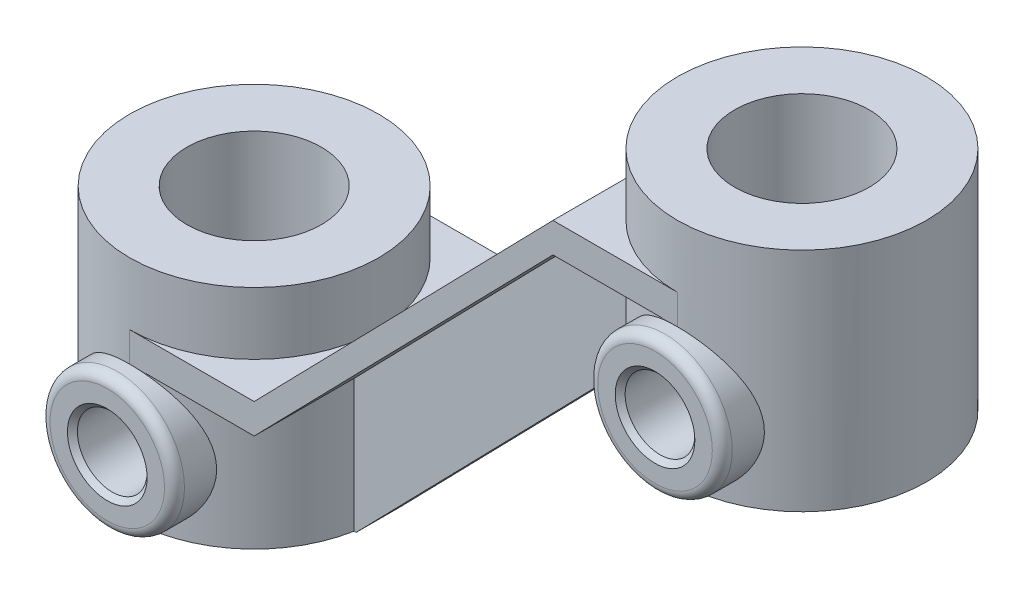
from build123d import *

# Parameters (mm, degrees)
BOSS_EXTRUDE1_START     = 61.5
SKETCH2_R               = 25
SKETCH2_R_2             = 13.5
BOSS_EXTRUDE1_DEPTH     = 45.5
SKETCH2_3_R             = 25
SKETCH2_3_R_2           = 13.5
BOSS_EXTRUDE2_DEPTH     = 45.5
BOSS_EXTRUDE3_DEPTH     = 25
BOSS_EXTRUDE5_REACH     = 205.566
BOSS_EXTRUDE5_START     = 29.5
SKETCH4_R               = 13.5
RIB1_START              = -4.5
RIB1_DEPTH              = 9
FILLET1_R               = 2
CUT_EXTRUDE3_DEPTH      = 175.769133569
CUT_EXTRUDE3_DEPTH_BACK = 52.5
SKETCH10_R              = 13.5


with BuildPart() as part:
    # Sketch2 → Boss-Extrude1 (new body)
    with BuildSketch(Plane(origin=(0, 0, 0), x_dir=(1, 0, 0), z_dir=(0, 1, 0)).offset(BOSS_EXTRUDE1_START)):
        with Locations(Location((110, 0, 0), (0, 0, 270))):
            Circle(SKETCH2_R)
        with Locations(Location((110, 0, 0), (0, 0, 270))):
            Circle(SKETCH2_R_2, mode=Mode.SUBTRACT)
    extrude(amount=BOSS_EXTRUDE1_DEPTH)



with BuildPart() as body_2:
    # Sketch2<3> → Boss-Extrude2 (new body)
    with BuildSketch(Plane(origin=(0, 0, 0), x_dir=(1, 0, 0), z_dir=(0, 1, 0))):
        with Locations(Location((0, 0, 0), (0, 0, 270))):
            Circle(SKETCH2_3_R)
        with Locations(Location((0, 0, 0), (0, 0, 270))):
            Circle(SKETCH2_3_R_2, mode=Mode.SUBTRACT)
    extrude(amount=BOSS_EXTRUDE2_DEPTH)


with BuildPart() as part_1:
    add(part.part)

    add(body_2.part)  # Boss-Extrude3 merges body 2
    # Sketch3 → Boss-Extrude3 (add, symmetric)
    with BuildSketch(Plane.XY):
        Polygon((0, 27), (25, 27), (85, 88.5), (110, 88.5), (110, 94.5), (85, 94.5), (25, 33), (0, 33), align=None)
    extrude(amount=BOSS_EXTRUDE3_DEPTH, both=True)

    # Sketch4 → Boss-Extrude5 (add, up to next)
    with BuildSketch(Plane.XY.offset(BOSS_EXTRUDE5_START), mode=Mode.PRIVATE) as boss_extrude5_sk1:
        with Locations((0, 13.5)):
            Circle(SKETCH4_R)
    boss_extrude5_tool1 = extrude(boss_extrude5_sk1.sketch, amount=-BOSS_EXTRUDE5_REACH, mode=Mode.PRIVATE) - part_1.part
    # Sketch4 → Boss-Extrude5 (add, up to next)
    with BuildSketch(Plane.XY.offset(BOSS_EXTRUDE5_START), mode=Mode.PRIVATE) as boss_extrude5_sk2:
        with Locations((110, 75)):
            Circle(SKETCH4_R)
    boss_extrude5_tool2 = extrude(boss_extrude5_sk2.sketch, amount=-BOSS_EXTRUDE5_REACH, mode=Mode.PRIVATE) - part_1.part
    add(boss_extrude5_tool1.solids().sort_by_distance((0, 13.5, 29.5))[0])
    add(boss_extrude5_tool2.solids().sort_by_distance((110, 75, 29.5))[0])

    # Rib1: read off the stored shape, not the designer's step
    # Rib1 outline → Rib1 (add)
    with BuildSketch(Plane.XY.offset(RIB1_START)):
        Polygon((85, 61.5), (85.408334745, 61.5), (85.408334745, 88.5), (85, 88.5), (25, 27), (24.591665255, 27), (24.591665255, 0), (25, 0), align=None)
    extrude(amount=RIB1_DEPTH)

    # CSK for M16 SFHCS1: read off the stored shape, not the designer's step
    # CSK for M16 SFHCS1 outline → CSK for M16 SFHCS1 (revolve, cut)
    with BuildSketch(Plane(origin=(110, 75, 0), x_dir=(1, 0, 0), z_dir=(0, -1, 0))):
        Polygon((0, 11.543091406), (7, 11.543091406), (7, 28.5), (8, 29.5), (0, 29.5), align=None)
    revolve(axis=Axis((110, 75, 0), (0, 0, 1)), mode=Mode.SUBTRACT)

    # CSK for M16 SFHCS1 2 outline → CSK for M16 SFHCS1 2 (revolve, cut)
    with BuildSketch(Plane.XZ.offset(-13.5)):
        Polygon((0, 11.543091406), (7, 11.543091406), (7, 28.5), (8, 29.5), (0, 29.5), align=None)
    revolve(axis=Axis((0, 13.5, 0), (0, 0, 1)), mode=Mode.SUBTRACT)

    # Fillet1
    fillet1_edges = [part_1.edges().sort_by_distance(p)[0] for p in [
        (-13.5, 13.5, 29.5),
        (96.5, 75, 29.5),
    ]]
    fillet(fillet1_edges, radius=FILLET1_R)

    # Sketch10 → Cut-Extrude3 (cut, two sides: drawn at the far end of the back side and taken through both)
    with BuildSketch(Plane(origin=(0, 0, 0), x_dir=(1, 0, 0), z_dir=(0, 1, 0)).offset(-CUT_EXTRUDE3_DEPTH_BACK)):
        with Locations(Location((0, 0, 0), (0, 0, 270))):
            Circle(SKETCH10_R)
        with Locations(Location((110, 0, 0), (0, 0, 270))):
            Circle(SKETCH10_R)
    extrude(amount=CUT_EXTRUDE3_DEPTH + CUT_EXTRUDE3_DEPTH_BACK, mode=Mode.SUBTRACT)


solid = part_1.part
